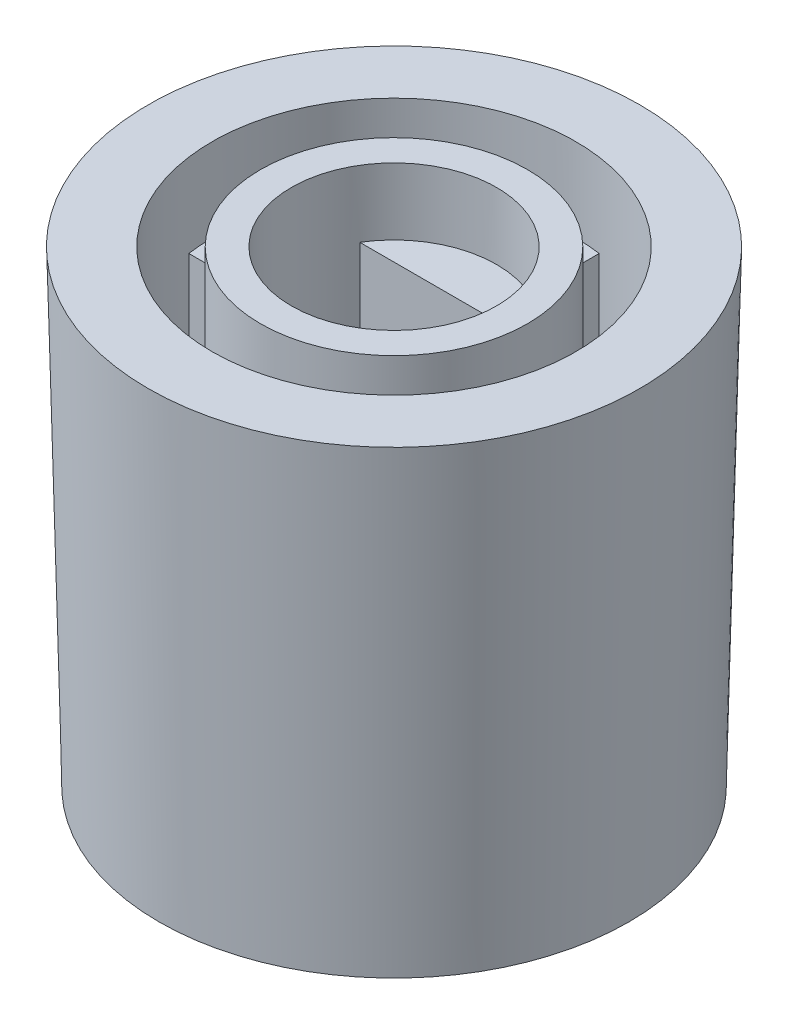
from build123d import *

# Parameters (mm, degrees)
SKETCH1_R           = 7.04
BOSS_EXTRUDE1_DEPTH = 3.5
SKETCH2_R           = 7.04
SKETCH2_R_2         = 5.45
BOSS_EXTRUDE2_DEPTH = 10.5
DRAFT1_ANGLE        = 1.325
SKETCH6_R           = 4
BOSS_EXTRUDE3_DEPTH = 10.5
CUT_EXTRUDE1_DEPTH  = 9
SKETCH7_R           = 3.075
CUT_EXTRUDE2_DEPTH  = 2
SKETCH8_W           = 2.525210291
SKETCH8_H           = 1.5
SKETCH8_W_2         = 2.122251202
SKETCH8_W_3         = 1.5
SKETCH8_H_2         = 2.337162717
SKETCH8_H_3         = 2.758031098
BOSS_EXTRUDE4_DEPTH = 8


with BuildPart() as part:
    # Sketch1 → Boss-Extrude1 (new body)
    with BuildSketch(Plane(origin=(0, 0, 0), x_dir=(1, 0, 0), z_dir=(0, 1, 0))):
        Circle(SKETCH1_R)
    extrude(amount=BOSS_EXTRUDE1_DEPTH)

    # Sketch2 → Boss-Extrude2 (add)
    with BuildSketch(Plane(origin=(0, 3.5, 0), x_dir=(1, 0, 0), z_dir=(0, 1, 0))):
        Circle(SKETCH2_R)
        Circle(SKETCH2_R_2, mode=Mode.SUBTRACT)
    extrude(amount=BOSS_EXTRUDE2_DEPTH)

    # Draft1
    draft1_faces = [part.faces().sort_by_distance(p)[0] for p in [
        (-7.04, 7, 0),
    ]]
    draft(draft1_faces, Plane(origin=(0, 0, 0), x_dir=(0, 0, -1), z_dir=(0, -1, 0)), DRAFT1_ANGLE)

    # Sketch6 → Boss-Extrude3 (add)
    with BuildSketch(Plane(origin=(0, 3.5, 0), x_dir=(1, 0, 0), z_dir=(0, 1, 0))):
        Circle(SKETCH6_R)
    extrude(amount=BOSS_EXTRUDE3_DEPTH)

    # Sketch5 → Cut-Extrude1 (cut)
    with BuildSketch(Plane(origin=(0, 14, 0), x_dir=(1, 0, 0), z_dir=(0, 1, 0))):
        with BuildLine():
            Line((2.625952208, 1.6), (-2.625952208, 1.6))
            ThreePointArc((-2.625952208, 1.6), (-0.83090973, -2.960610413), (3.075, 0))
            ThreePointArc((3.075, 0), (2.960610413, 0.83090973), (2.625952208, 1.6))
        make_face()
    extrude(amount=-CUT_EXTRUDE1_DEPTH, mode=Mode.SUBTRACT)

    # Sketch7 → Cut-Extrude2 (cut)
    with BuildSketch(Plane(origin=(0, 14, 0), x_dir=(1, 0, 0), z_dir=(0, 1, 0))):
        Circle(SKETCH7_R)
    extrude(amount=-CUT_EXTRUDE2_DEPTH, mode=Mode.SUBTRACT)

    # Sketch8 → Boss-Extrude4 (add)
    with BuildSketch(Plane(origin=(0, 3.5, 0), x_dir=(1, 0, 0), z_dir=(0, 1, 0))):
        with Locations((-4.853418362, 0)):
            Rectangle(SKETCH8_W, SKETCH8_H)
        with Locations((4.696712049, 0)):
            Rectangle(SKETCH8_W_2, SKETCH8_H)
        with Locations((0, 4.745962605)):
            Rectangle(SKETCH8_W_3, SKETCH8_H_2)
        with Locations((0, -4.822077099)):
            Rectangle(SKETCH8_W_3, SKETCH8_H_3)
    extrude(amount=BOSS_EXTRUDE4_DEPTH)


solid = part.part
